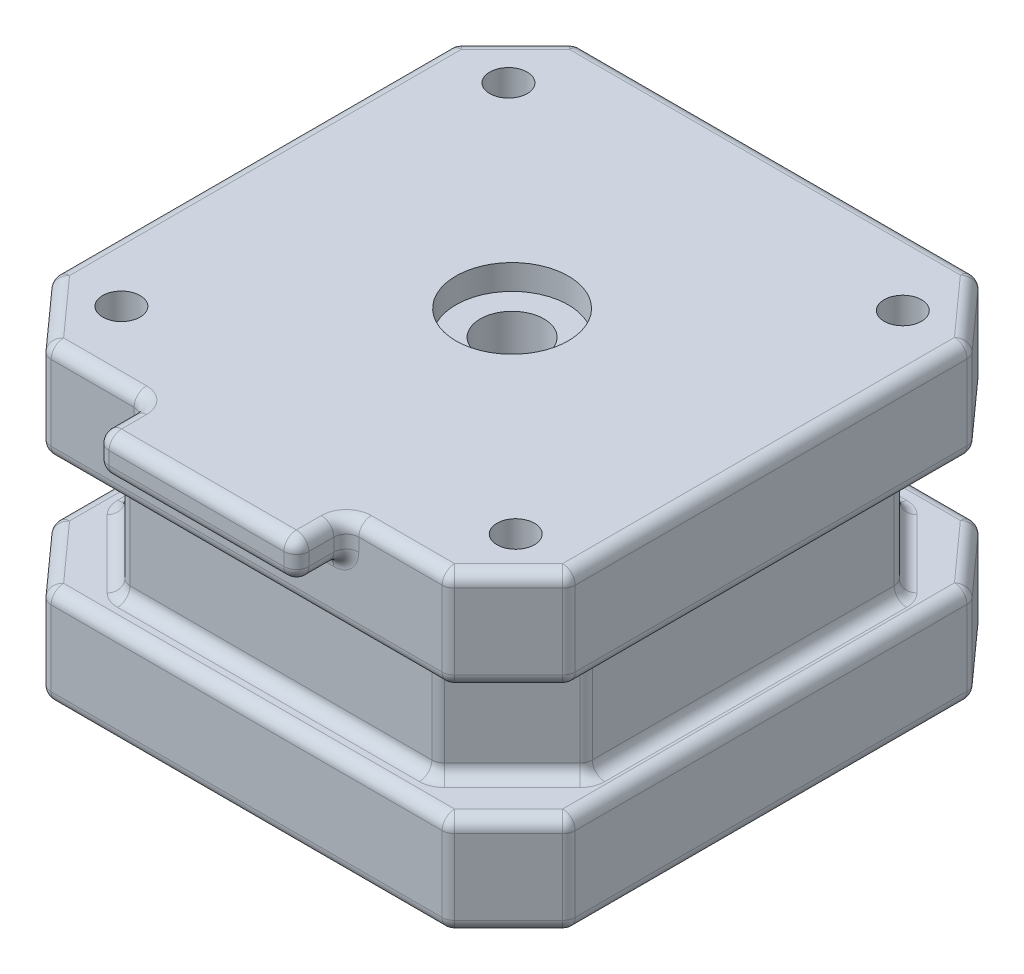
from build123d import *

# Parameters (mm, degrees)
BOSS_EXTRUDE1_DEPTH = 8.02
SKETCH2_R           = 1.5
CUT_EXTRUDE1_DEPTH  = 6
SKETCH3_R           = 11
SKETCH3_R_2         = 4.5
BOSS_EXTRUDE2_DEPTH = 2
BOSS_EXTRUDE3_DEPTH = 9
SKETCH4_R           = 2.55
CUT_EXTRUDE2_DEPTH  = 39.987035572
SKETCH6_R           = 4.5
CUT_EXTRUDE3_DEPTH  = 2
SKETCH8_W           = 16
SKETCH8_H           = 4
BOSS_EXTRUDE5_DEPTH = 3.04
FILLET1_R           = 1


with BuildPart() as part:
    # Sketch1 → Boss-Extrude1 (new body)
    with BuildSketch(Plane(origin=(0, 0, 0), x_dir=(1, 0, 0), z_dir=(0, 1, 0))):
        Polygon((16.085, 21.260594368), (-16.085, 21.260594368), (-20.999392129, 16.346202238), (-20.999392129, -15.823797762), (-16.360887743, -20.999392129), (15.809112257, -20.999392129), (20.723504386, -16.085), (20.723504386, 16.085), align=None)
    boss_extrude1 = extrude(amount=BOSS_EXTRUDE1_DEPTH)

    # Sketch2 → Cut-Extrude1 (cut)
    with BuildSketch(Plane.XZ):
        with Locations((-15.79, 15.5)):
            Circle(SKETCH2_R)
        with Locations((15.79, 15.5)):
            Circle(SKETCH2_R)
        with Locations((-15.79, -15.5)):
            Circle(SKETCH2_R)
        with Locations((15.79, -15.5)):
            Circle(SKETCH2_R)
    cut_extrude1 = extrude(amount=-CUT_EXTRUDE1_DEPTH, mode=Mode.SUBTRACT)

    # Sketch3 → Boss-Extrude2 (add)
    with BuildSketch(Plane.XZ):
        Circle(SKETCH3_R)
        Circle(SKETCH3_R_2, mode=Mode.SUBTRACT)
    extrude(amount=BOSS_EXTRUDE2_DEPTH)

    # Sketch5 → Boss-Extrude3 (add)
    with BuildSketch(Plane(origin=(0, 8.02, 0), x_dir=(1, 0, 0), z_dir=(0, 1, 0))):
        Polygon((-18.51040764, 12.5), (-12.5, 18.51040764), (12.5, 18.51040764), (18.51040764, 12.5), (18.51040764, -12.5), (12.5, -18.51040764), (-12.5, -18.51040764), (-18.51040764, -12.5), align=None)
    extrude(amount=BOSS_EXTRUDE3_DEPTH)

    # Mirror1: Boss-Extrude1, Cut-Extrude1 across plane
    add(boss_extrude1.mirror(Plane(origin=(0, 12.52, 0), x_dir=(0, 0, 1), z_dir=(0, -1, 0))))
    add(cut_extrude1.mirror(Plane(origin=(0, 12.52, 0), x_dir=(0, 0, 1), z_dir=(0, -1, 0))), mode=Mode.SUBTRACT)

    # Sketch4 → Cut-Extrude2 (cut, through all)
    with BuildSketch(Plane.XZ):
        Circle(SKETCH4_R)
    extrude(amount=-CUT_EXTRUDE2_DEPTH, mode=Mode.SUBTRACT)

    # Sketch6 → Cut-Extrude3 (cut)
    with BuildSketch(Plane(origin=(0, 25.04, 0), x_dir=(1, 0, 0), z_dir=(0, 1, 0))):
        Circle(SKETCH6_R)
    extrude(amount=-CUT_EXTRUDE3_DEPTH, mode=Mode.SUBTRACT)

    # Sketch8 → Boss-Extrude5 (add)
    with BuildSketch(Plane(origin=(0, 25.04, 0), x_dir=(1, 0, 0), z_dir=(0, 1, 0))):
        with Locations((-0.275887743, -22.999392129)):
            Rectangle(SKETCH8_W, SKETCH8_H)
    extrude(amount=-BOSS_EXTRUDE5_DEPTH)

    # Fillet1
    fillet1_edges = [part.edges().sort_by_distance(p)[0] for p in [
        (7.724112257, 23.52, 20.999392129),
        (7.724112257, 23.52, 24.999392129),
        (-8.275887743, 23.52, 24.999392129),
        (-8.275887743, 23.52, 20.999392129),
        (-0.275887743, 22, 20.999392129),
        (-8.275887743, 22, 22.999392129),
        (-0.275887743, 22, 24.999392129),
        (7.724112257, 22, 22.999392129),
        (12.5, 12.52, -18.51040764),
        (-12.5, 12.52, -18.51040764),
        (-18.51040764, 12.52, -12.5),
        (18.51040764, 12.52, -12.5),
        (-18.51040764, 12.52, 12.5),
        (18.51040764, 12.52, 12.5),
        (-12.5, 12.52, 18.51040764),
        (12.5, 12.52, 18.51040764),
        (-16.085, 4.01, -21.260594368),
        (-20.999392129, 4.01, -16.346202238),
        (-20.999392129, 21.03, -16.346202238),
        (-16.085, 21.03, -21.260594368),
        (-16.360887743, 21.03, 20.999392129),
        (-20.999392129, 21.03, 15.823797762),
        (20.723504386, 21.03, 16.085),
        (15.809112257, 21.03, 20.999392129),
        (16.085, 21.03, -21.260594368),
        (20.723504386, 21.03, -16.085),
        (20.723504386, 4.01, -16.085),
        (16.085, 4.01, -21.260594368),
        (20.723504386, 4.01, 16.085),
        (-16.360887743, 4.01, 20.999392129),
        (15.809112257, 4.01, 20.999392129),
        (20.723504386, 8.02, 0),
        (18.266308322, 8.02, 18.542196065),
        (-0.275887743, 8.02, 20.999392129),
        (-18.680139936, 8.02, 18.411594945),
        (-20.999392129, 8.02, -0.261202238),
        (-18.542196065, 8.02, -18.803398303),
        (0, 8.02, -21.260594368),
        (18.404252193, 8.02, -18.672797184),
        (-15.50520382, 8.02, 15.50520382),
        (0, 8.02, 18.51040764),
        (15.50520382, 8.02, 15.50520382),
        (18.51040764, 8.02, 0),
        (15.50520382, 8.02, -15.50520382),
        (0, 8.02, -18.51040764),
        (-15.50520382, 8.02, -15.50520382),
        (-18.51040764, 8.02, 0),
        (0, 0, -21.260594368),
        (-18.542196065, 0, -18.803398303),
        (-20.999392129, 0, -0.261202238),
        (-18.680139936, 0, 18.411594945),
        (-0.275887743, 0, 20.999392129),
        (18.266308322, 0, 18.542196065),
        (20.723504386, 0, 0),
        (18.404252193, 0, -18.672797184),
        (0, 17.02, -21.260594368),
        (-18.542196065, 17.02, -18.803398303),
        (-20.999392129, 17.02, -0.261202238),
        (-18.680139936, 17.02, 18.411594945),
        (-0.275887743, 17.02, 20.999392129),
        (18.266308322, 17.02, 18.542196065),
        (20.723504386, 17.02, 0),
        (18.404252193, 17.02, -18.672797184),
        (0, 17.02, -18.51040764),
        (15.50520382, 17.02, -15.50520382),
        (18.51040764, 17.02, 0),
        (15.50520382, 17.02, 15.50520382),
        (0, 17.02, 18.51040764),
        (-15.50520382, 17.02, 15.50520382),
        (-18.51040764, 17.02, 0),
        (-15.50520382, 17.02, -15.50520382),
        (20.723504386, 25.04, 0),
        (18.266308322, 25.04, 18.542196065),
        (11.766612257, 25.04, 20.999392129),
        (7.724112257, 25.04, 22.999392129),
        (-0.275887743, 25.04, 24.999392129),
        (-8.275887743, 25.04, 22.999392129),
        (-12.318387743, 25.04, 20.999392129),
        (-18.680139936, 25.04, 18.411594945),
        (-20.999392129, 25.04, -0.261202238),
        (-18.542196065, 25.04, -18.803398303),
        (0, 25.04, -21.260594368),
        (18.404252193, 25.04, -18.672797184),
        (-20.999392129, 4.01, 15.823797762),
    ]]
    fillet(fillet1_edges, radius=FILLET1_R)


solid = part.part
